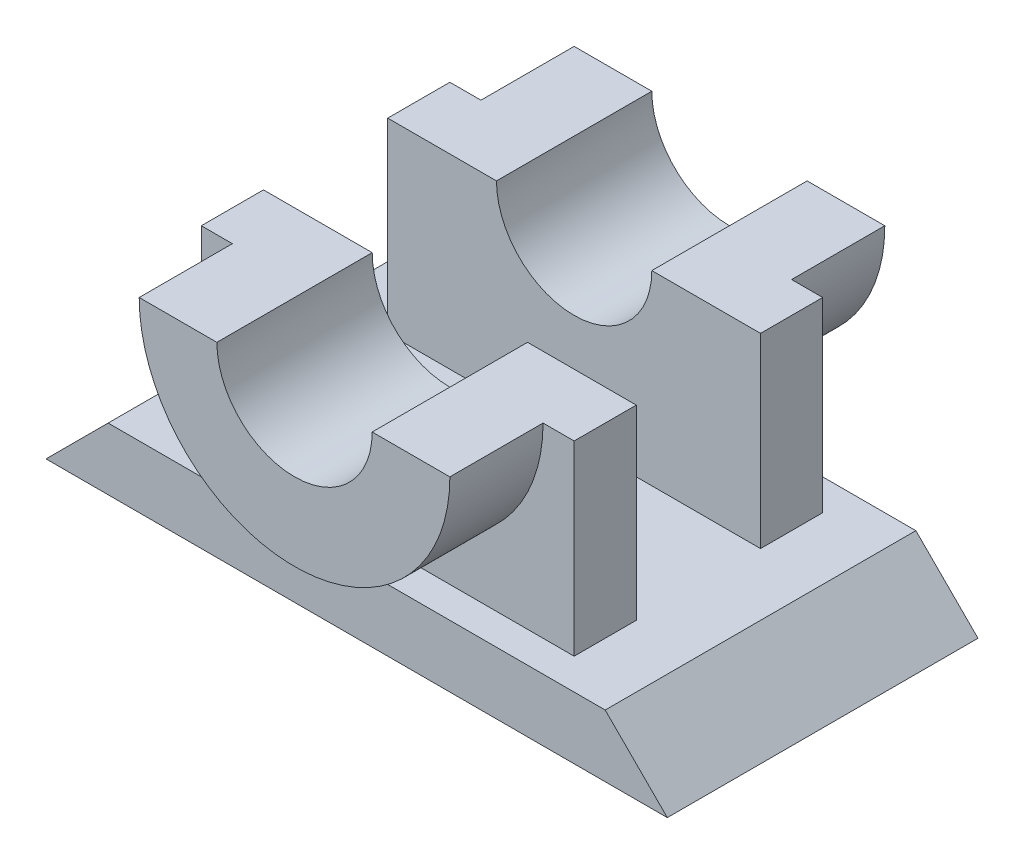
from build123d import *

# Parameters (mm, degrees)
SKETCH1_W           = 100
SKETCH1_H           = 50
BOSS_EXTRUDE1_DEPTH = 10
CHAMFER1_SIZE       = 10
CHAMFER2_SIZE       = 10
SKETCH2_W           = 60
SKETCH2_H           = 10
BOSS_EXTRUDE3_DEPTH = 40
CUT_EXTRUDE1_DEPTH  = 64
BOSS_EXTRUDE5_START = 15
BOSS_EXTRUDE5_DEPTH = 15
BOSS_EXTRUDE6_DEPTH = 15


with BuildPart() as part:
    # Sketch1 → Boss-Extrude1 (new body)
    with BuildSketch(Plane(origin=(0, 0, 0), x_dir=(1, 0, 0), z_dir=(0, 1, 0))):
        Rectangle(SKETCH1_W, SKETCH1_H)
    extrude(amount=BOSS_EXTRUDE1_DEPTH)

    # Chamfer1
    chamfer1_edges = [part.edges().sort_by_distance(p)[0] for p in [
        (-50, 10, 0),
    ]]
    chamfer(chamfer1_edges, length=CHAMFER1_SIZE - 0.0001)  # a hair under: the kernel refuses the full size

    # Chamfer2
    chamfer2_edges = [part.edges().sort_by_distance(p)[0] for p in [
        (50, 10, 0),
    ]]
    chamfer(chamfer2_edges, length=CHAMFER2_SIZE - 0.0001)  # a hair under: the kernel refuses the full size

    # Sketch2 → Boss-Extrude3 (add)
    with BuildSketch(Plane(origin=(0, 0, 0), x_dir=(1, 0, 0), z_dir=(0, 1, 0))):
        with Locations((0, -15)):
            Rectangle(SKETCH2_W, SKETCH2_H)
        with Locations((0, 15)):
            Rectangle(SKETCH2_W, SKETCH2_H)
    extrude(amount=BOSS_EXTRUDE3_DEPTH)

    # Sketch4 → Cut-Extrude1 (cut)
    with BuildSketch(Plane.XY.offset(20)):
        with BuildLine():
            Line((-12.5, 40), (12.5, 40))
            ThreePointArc((12.5, 40), (0, 27.5), (-12.5, 40))
        make_face()
    extrude(amount=-CUT_EXTRUDE1_DEPTH, mode=Mode.SUBTRACT)

    # Sketch10 → Boss-Extrude5 (add)
    with BuildSketch(Plane.XY.offset(20).offset(BOSS_EXTRUDE5_START)):
        with BuildLine():
            Line((-25, 40), (-12.5, 40))
            ThreePointArc((-12.5, 40), (0, 27.5), (12.5, 40))
            Line((12.5, 40), (25, 40))
            ThreePointArc((25, 40), (0, 15), (-25, 40))
        make_face()
    extrude(amount=-BOSS_EXTRUDE5_DEPTH)

    # Sketch11 → Boss-Extrude6 (add)
    with BuildSketch(Plane(origin=(0, 0, -20), x_dir=(-1, 0, 0), z_dir=(0, 0, -1))):
        with BuildLine():
            Line((-12.5, 40), (-25, 40))
            ThreePointArc((-25, 40), (0, 15), (25, 40))
            Line((25, 40), (12.5, 40))
            ThreePointArc((12.5, 40), (0, 27.5), (-12.5, 40))
        make_face()
    extrude(amount=BOSS_EXTRUDE6_DEPTH)


solid = part.part
